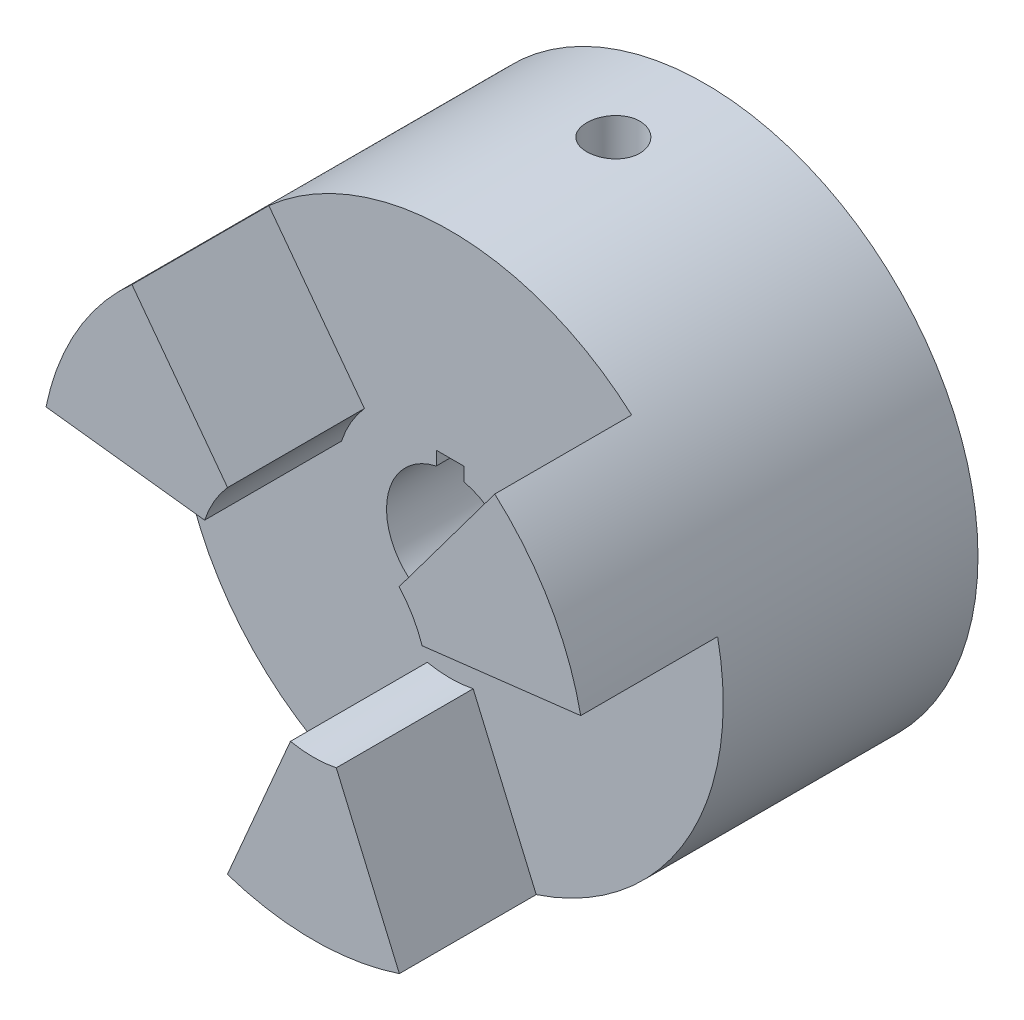
from build123d import *

# Parameters (mm, degrees)
SZKIC1_R                    = 47.625
DODANIE_WYCI_GNI_CIE1_DEPTH = 44.45
WYTNIJ_WYCI_GNI_CIE1_REACH  = 82.697
DODANIE_WYCI_GNI_CIE2_DEPTH = 23.88
SZYK_KO_OWY1_COUNT          = 3
SZKIC4_R                    = 4.63
WYTNIJ_WYCI_GNI_CIE2_DEPTH  = 8.64


with BuildPart() as part:
    # Szkic1 → Dodanie-wyciągnięcie1 (new body)
    with BuildSketch(Plane.XY):
        Circle(SZKIC1_R)
    extrude(amount=DODANIE_WYCI_GNI_CIE1_DEPTH)

    # Szkic2 → Wytnij-wyciągnięcie1 (cut, up to next)
    with BuildSketch(Plane.XY.offset(44.45), mode=Mode.PRIVATE) as wytnij_wyci_gni_cie1_sk1:
        with BuildLine():
            Line((-2.44, 13.233874999), (2.44, 13.233874999))
            Line((2.44, 13.233874999), (2.44, 10.843874999))
            ThreePointArc((2.44, 10.843874999), (0, -11.115), (-2.44, 10.843874999))
            Line((-2.44, 10.843874999), (-2.44, 13.233874999))
        make_face()
    wytnij_wyci_gni_cie1_tool1 = extrude(wytnij_wyci_gni_cie1_sk1.sketch, amount=-WYTNIJ_WYCI_GNI_CIE1_REACH, mode=Mode.PRIVATE) & part.part
    add(wytnij_wyci_gni_cie1_tool1.solids().sort_by_distance((0, 0.327718, 44.45))[0], mode=Mode.SUBTRACT)

    # Szkic3 → Dodanie-wyciągnięcie2 (add)
    with BuildSketch(Plane.XY.offset(44.45)):
        with BuildLine():
            ThreePointArc((4, -19.595917942), (0, -20), (-4, -19.595917942))
            Line((-4, -19.595917942), (-15, -45.201113095))
            ThreePointArc((-15, -45.201113095), (0, -47.625), (15, -45.201113095))
            Line((15, -45.201113095), (4, -19.595917942))
        make_face()
    dodanie_wyci_gni_cie2 = extrude(amount=DODANIE_WYCI_GNI_CIE2_DEPTH)

    # Szyk kołowy1: Dodanie-wyciągnięcie2 ×3 about axis
    szyk_ko_owy1_axis = Axis((0, 0, 44.45), (0, 0, 1))
    for i in range(1, SZYK_KO_OWY1_COUNT):
        add(dodanie_wyci_gni_cie2.rotate(szyk_ko_owy1_axis, i * 360 / SZYK_KO_OWY1_COUNT))

    # Szkic4 → Wytnij-wyciągnięcie2 (cut)
    with BuildSketch(Plane(origin=(0, 47.625, 0), x_dir=(1, 0, 0), z_dir=(0, 1, 0))):
        with Locations((0, -16)):
            Circle(SZKIC4_R)
    extrude(amount=-WYTNIJ_WYCI_GNI_CIE2_DEPTH, mode=Mode.SUBTRACT)


solid = part.part
